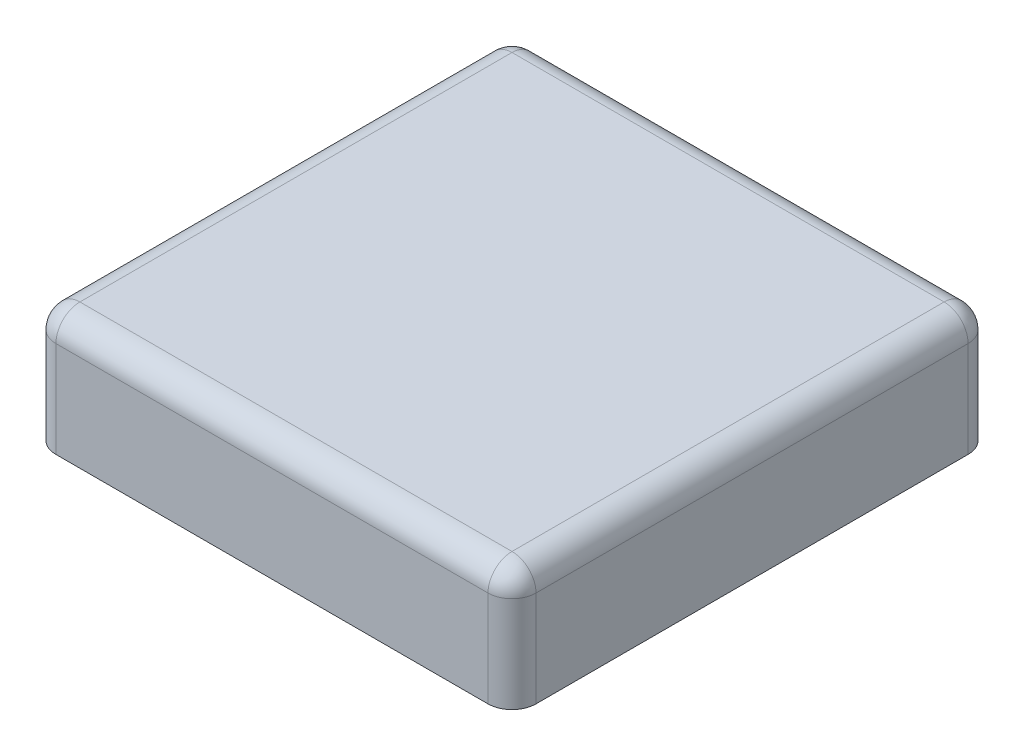
from build123d import *

# Parameters (mm, degrees)
SKETCH1_W           = 6
SKETCH1_H           = 6
BOSS_EXTRUDE1_DEPTH = 1.5
FILLET1_R           = 0.3
SHELL1_START        = -2.7
SHELL1_OUTLINE_W    = 1.2
SHELL1_OUTLINE_H    = 5.4
SHELL1_DEPTH        = 5.4


# Read off the part's stored shape, not the designer's step: Shell1
with BuildPart() as part:
    # Sketch1 → Boss-Extrude1 (new body)
    with BuildSketch(Plane(origin=(0, 0, 0), x_dir=(1, 0, 0), z_dir=(0, 1, 0))):
        Rectangle(SKETCH1_W, SKETCH1_H)
    extrude(amount=BOSS_EXTRUDE1_DEPTH)

    # Fillet1
    fillet1_edges = [part.edges().sort_by_distance(p)[0] for p in [
        (-3, 1.5, 0),
        (0, 1.5, 3),
        (3, 1.5, 0),
        (3, 0.75, 3),
        (-3, 0.75, 3),
        (-3, 0.75, -3),
        (3, 0.75, -3),
        (0, 1.5, -3),
    ]]
    fillet(fillet1_edges, radius=FILLET1_R)

    # Shell1 outline → Shell1 (cut)
    with BuildSketch(Plane.YZ.offset(SHELL1_START)):
        with Locations((0.6, 0)):
            Rectangle(SHELL1_OUTLINE_W, SHELL1_OUTLINE_H)
    extrude(amount=SHELL1_DEPTH, mode=Mode.SUBTRACT)


solid = part.part
